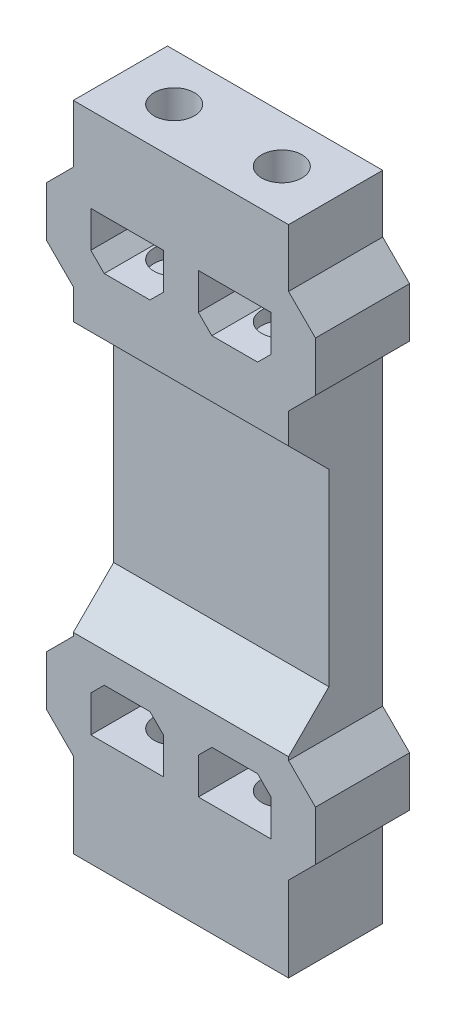
from build123d import *

# Parameters (mm, degrees)
SKETCH1_W           = 16
SKETCH1_H           = 48.5
BOSS_EXTRUDE1_DEPTH = 7
SKETCH2_W           = 5.4
SKETCH2_H           = 3.7
CUT_EXTRUDE1_DEPTH  = 27.47758486
SKETCH3_OUTSIDE_W   = 28.31
SKETCH3_OUTSIDE_H   = 19.31
SKETCH3_OUTSIDE_W_2 = 16
SKETCH3_OUTSIDE_H_2 = 7
SKETCH3_OUTSIDE_R   = 1.5
CUT_EXTRUDE2_DEPTH  = 11
SKETCH4_W           = 16
SKETCH4_H           = 20
CUT_EXTRUDE3_DEPTH  = 3
CHAMFER1_SIZE       = 3
SKETCH5_W           = 2
SKETCH5_H           = 7.7
BOSS_EXTRUDE2_DEPTH = 7
CHAMFER2_SIZE       = 2
CHAMFER3_SIZE       = 1


with BuildPart() as part:
    # Sketch1 → Boss-Extrude1 (new body)
    with BuildSketch(Plane.XY):
        Rectangle(SKETCH1_W, SKETCH1_H)
    extrude(amount=BOSS_EXTRUDE1_DEPTH)

    # Sketch2 → Cut-Extrude1 (cut, through all)
    with BuildSketch(Plane.XY.offset(7)):
        with Locations((-4, 16.1)):
            Rectangle(SKETCH2_W, SKETCH2_H)
        with Locations((4, 16.1)):
            Rectangle(SKETCH2_W, SKETCH2_H)
        with Locations((4, -14.1)):
            Rectangle(SKETCH2_W, SKETCH2_H)
        with Locations((-4, -14.1)):
            Rectangle(SKETCH2_W, SKETCH2_H)
    extrude(amount=-CUT_EXTRUDE1_DEPTH, mode=Mode.SUBTRACT)

    # Sketch3 outside → Cut-Extrude2 (cut)
    # profile 1 of 3: a face of its own
    with BuildSketch(Plane(origin=(0, 24.25, 0), x_dir=(1, 0, 0), z_dir=(0, 1, 0))):
        with Locations((0, -3.5)):
            Rectangle(SKETCH3_OUTSIDE_W, SKETCH3_OUTSIDE_H)
        with Locations((0, -3.5)):
            Rectangle(SKETCH3_OUTSIDE_W_2, SKETCH3_OUTSIDE_H_2, mode=Mode.SUBTRACT)
    # profile 2 of 3: a face of its own
    with BuildSketch(Plane(origin=(0, 24.25, 0), x_dir=(1, 0, 0), z_dir=(0, 1, 0))):
        with Locations(Location((4, -3.5, 0), (0, 0, 270))):
            Circle(SKETCH3_OUTSIDE_R)
    # profile 3 of 3: a face of its own
    with BuildSketch(Plane(origin=(0, 24.25, 0), x_dir=(1, 0, 0), z_dir=(0, 1, 0))):
        with Locations(Location((-4, -3.5, 0), (0, 0, 270))):
            Circle(SKETCH3_OUTSIDE_R)
    cut_extrude2 = extrude(amount=-CUT_EXTRUDE2_DEPTH, mode=Mode.SUBTRACT)

    # Mirror1: Cut-Extrude2 across plane
    add(cut_extrude2.mirror(Plane.ZX), mode=Mode.SUBTRACT)

    # Sketch4 → Cut-Extrude3 (cut)
    with BuildSketch(Plane.XY.offset(7)):
        Rectangle(SKETCH4_W, SKETCH4_H)
    extrude(amount=-CUT_EXTRUDE3_DEPTH, mode=Mode.SUBTRACT)

    # Chamfer1
    chamfer1_edges = [part.edges().sort_by_distance(p)[0] for p in [
        (0, -10, 4),
        (0, 10, 4),
    ]]
    chamfer(chamfer1_edges, length=CHAMFER1_SIZE - 0.0001)  # a hair under: the kernel refuses the full size

    # Sketch5 → Boss-Extrude2 (add)
    with BuildSketch(Plane(origin=(0, 0, 0), x_dir=(-1, 0, 0), z_dir=(0, 0, -1))):
        with Locations((9, 16.1)):
            Rectangle(SKETCH5_W, SKETCH5_H)
        with Locations((-9, 16.1)):
            Rectangle(SKETCH5_W, SKETCH5_H)
        with Locations((-9, -14.1)):
            Rectangle(SKETCH5_W, SKETCH5_H)
        with Locations((9, -14.1)):
            Rectangle(SKETCH5_W, SKETCH5_H)
    extrude(amount=-BOSS_EXTRUDE2_DEPTH)

    # Chamfer2
    chamfer2_edges = [part.edges().sort_by_distance(p)[0] for p in [
        (-10, -17.95, 3.5),
        (-10, -10.25, 3.5),
        (10, -17.95, 3.5),
        (10, -10.25, 3.5),
        (10, 12.25, 3.5),
        (10, 19.95, 3.5),
        (-10, 12.25, 3.5),
        (-10, 19.95, 3.5),
    ]]
    chamfer(chamfer2_edges, length=CHAMFER2_SIZE - 0.0001)  # a hair under: the kernel refuses the full size

    # Chamfer3
    chamfer3_edges = [part.edges().sort_by_distance(p)[0] for p in [
        (-6.7, -12.25, 3.5),
        (-1.3, -12.25, 3.5),
        (6.7, -12.25, 3.5),
        (1.3, -12.25, 3.5),
        (6.7, 14.25, 3.5),
        (1.3, 14.25, 3.5),
        (-1.3, 14.25, 3.5),
        (-6.7, 14.25, 3.5),
    ]]
    chamfer(chamfer3_edges, length=CHAMFER3_SIZE)


solid = part.part
